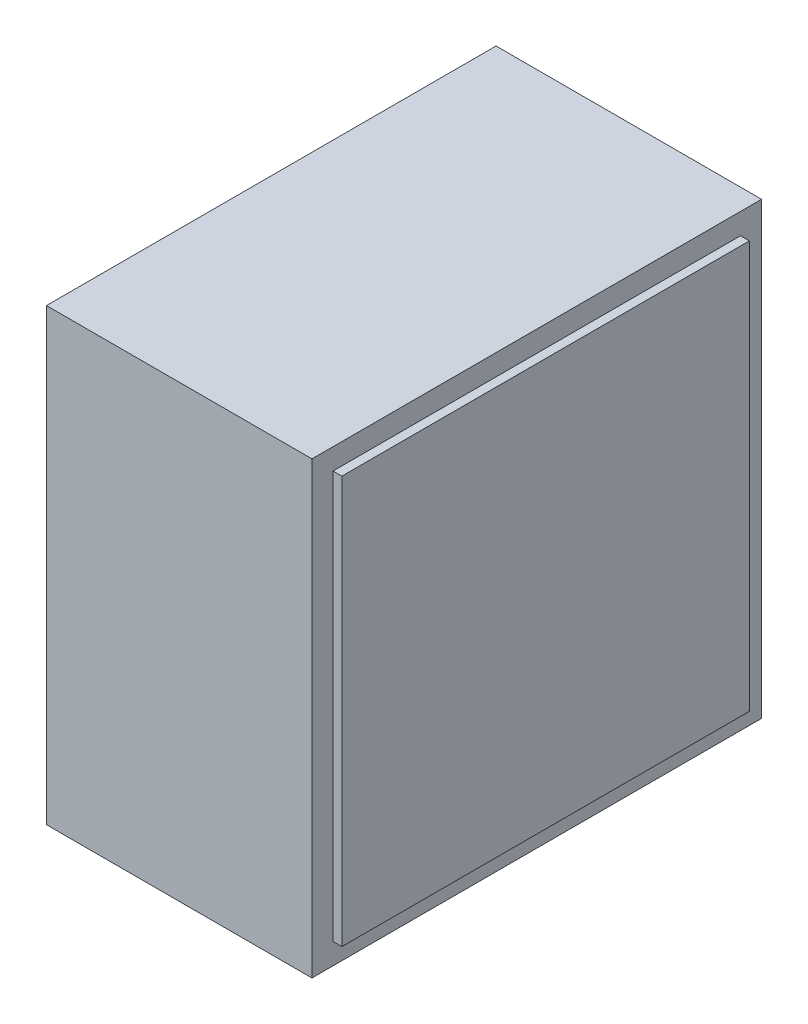
from build123d import *

# Parameters (mm, degrees)
MEMBER_1_OUTLINE_W               = 101.6
MEMBER_1_OUTLINE_H               = 101.6
MEMBER_1_OUTLINE_W_2             = 92.075
MEMBER_1_OUTLINE_H_2             = 92.075
MEMBER_1_DEPTH                   = 60
ENDCAP_T2_STRUCTURAL_INSET       = 4.7625
ENDCAP_T2_STRUCTURAL_THICKNESS   = 2
ENDCAP_T2_STRUCTURAL_4_INSET     = 4.7625
ENDCAP_T2_STRUCTURAL_4_THICKNESS = 2


# Read off the part's stored shape, not the designer's step: the member step
with BuildPart() as part:
    # Member 1 outline → Member 1 (new body)
    with BuildSketch(Plane.YZ):
        Rectangle(MEMBER_1_OUTLINE_W, MEMBER_1_OUTLINE_H)
        Rectangle(MEMBER_1_OUTLINE_W_2, MEMBER_1_OUTLINE_H_2, mode=Mode.SUBTRACT)
    extrude(amount=MEMBER_1_DEPTH)


with BuildPart() as body_2:
    # endcap_t2_structural: an end cap: a plate 2.0 thick on the member's open end, its outline the end's outer outline set in by 4.7625
    endcap_t2_structural_end = part.part.faces().sort_by_distance((0, 49.276, 49.276))[0]
    add(extrude(Face(endcap_t2_structural_end.outer_wire().offset_2d(-ENDCAP_T2_STRUCTURAL_INSET)), amount=ENDCAP_T2_STRUCTURAL_THICKNESS, dir=(-1, 0, 0)))


with BuildPart() as body_3:
    # endcap_t2_structural 4: an end cap: a plate 2.0 thick on the member's open end, its outline the end's outer outline set in by 4.7625
    endcap_t2_structural_4_end = part.part.faces().sort_by_distance((60, 49.276, -49.276))[0]
    add(extrude(Face(endcap_t2_structural_4_end.outer_wire().offset_2d(-ENDCAP_T2_STRUCTURAL_4_INSET)), amount=ENDCAP_T2_STRUCTURAL_4_THICKNESS, dir=(1, 0, 0)))


solid = Compound([part.part, body_2.part, body_3.part])
